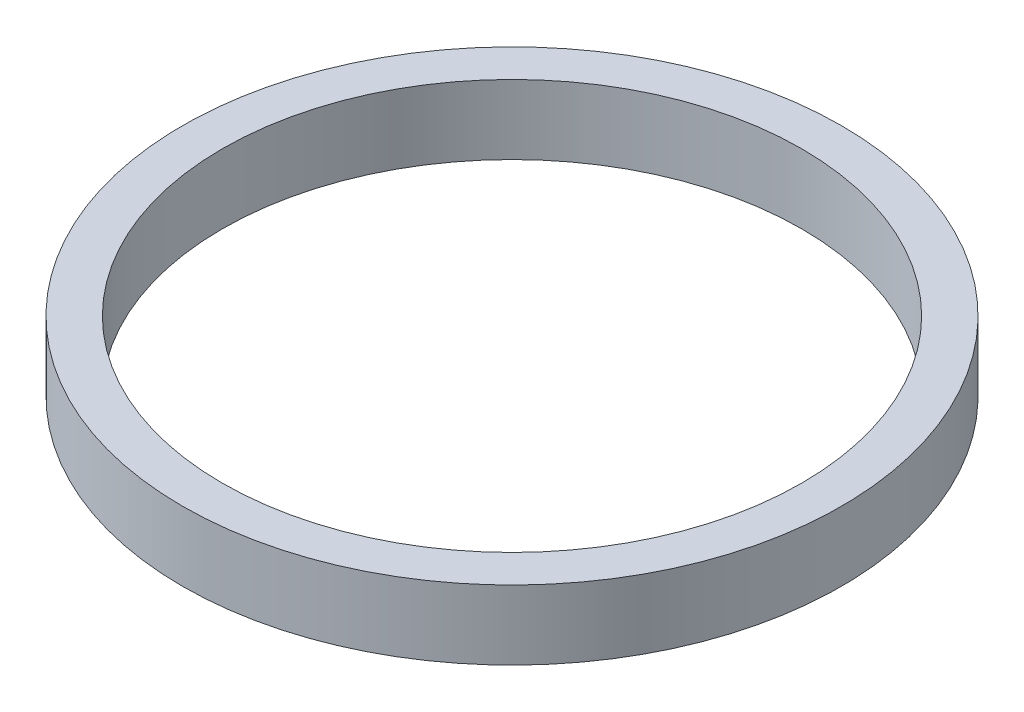
from build123d import *

# Parameters (mm, degrees)
SKETCH_1_R      = 19
SKETCH_1_R_2    = 16.7
EXTRUDE_1_DEPTH = 4


with BuildPart() as part:
    # Эскиз1 → Бобышка-Вытянуть1 (new body)
    with BuildSketch(Plane(origin=(0, 0, 0), x_dir=(1, 0, 0), z_dir=(0, 1, 0))):
        Circle(SKETCH_1_R)
        Circle(SKETCH_1_R_2, mode=Mode.SUBTRACT)
    extrude(amount=EXTRUDE_1_DEPTH)


solid = part.part
